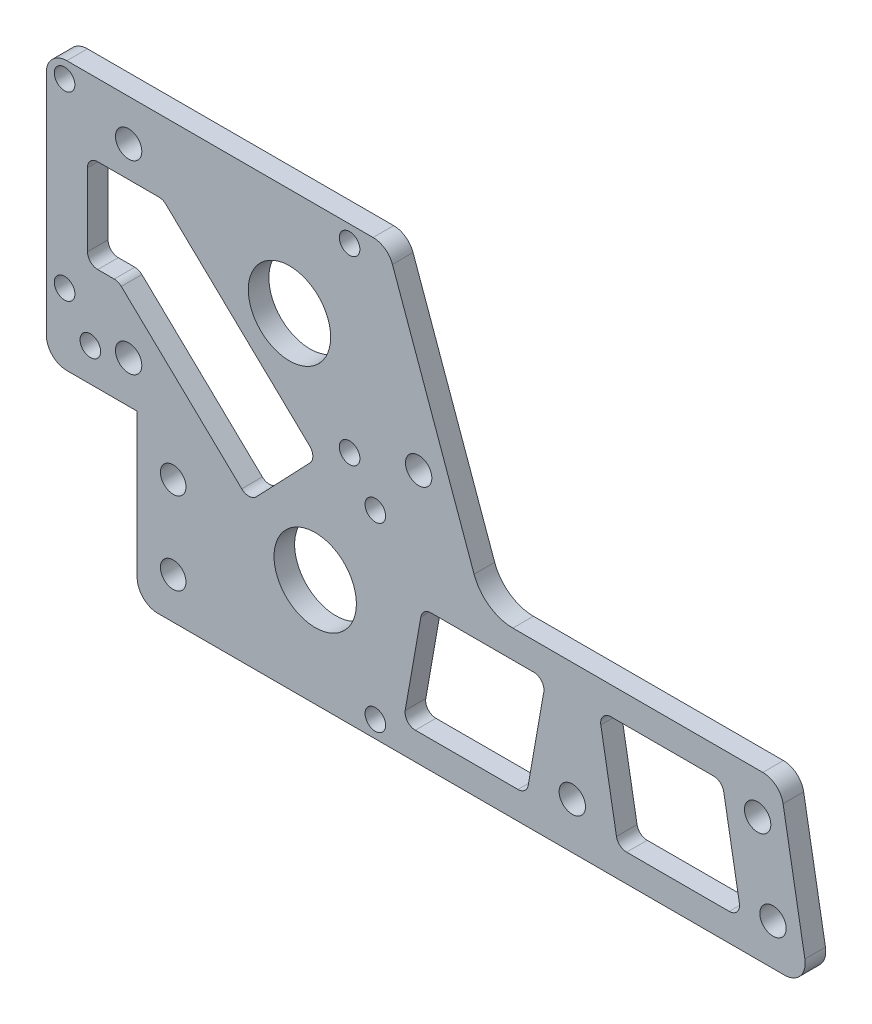
from build123d import *

# Parameters (mm, degrees)
BOSS_EXTRUDE1_DEPTH = 3.175
SKETCH2_R           = 6.35
SKETCH2_R_2         = 1.5875
SKETCH2_R_3         = 2.032
CUT_EXTRUDE1_DEPTH  = 123.537765163
SKETCH3_R           = 2.032
SKETCH3_R_2         = 1.9685
CUT_EXTRUDE2_DEPTH  = 123.537765163
FILLET1_R           = 3.175
SKETCH4_R           = 2.032
CUT_EXTRUDE3_DEPTH  = 123.027997459
CUT_EXTRUDE4_REACH  = 124.028
FILLET2_R           = 1.5875


with BuildPart() as part:
    # Sketch1 → Boss-Extrude1 (new body)
    with BuildSketch(Plane.XY):
        with BuildLine():
            Line((102.692805421, 0), (-0.911395616, 0))
            Line((-0.911395616, 0), (-0.911395616, 25.4))
            Line((-0.911395616, 25.4), (-14.924855892, 25.4))
            Line((-14.924855892, 25.4), (-14.924855892, 63.605318816))
            ThreePointArc((-14.924855892, 63.605318816), (-13.994919922, 65.850382846), (-11.749855892, 66.780318816))
            Line((-11.749855892, 66.780318816), (35.462394108, 66.780318816))
            ThreePointArc((35.462394108, 66.780318816), (37.289381836, 66.201997626), (38.450803758, 64.677714623))
            Line((38.450803758, 64.677714623), (51.036631355, 29.605208386))
            ThreePointArc((51.036631355, 29.605208386), (53.359475199, 26.556642379), (57.013450653, 25.4))
            Line((57.013450653, 25.4), (98.214100111, 25.4))
            Line((98.214100111, 25.4), (102.692805421, 0))
        make_face()
    extrude(amount=BOSS_EXTRUDE1_DEPTH)

    # Sketch2 → Cut-Extrude1 (cut, through all)
    with BuildSketch(Plane.XY.offset(3.175)):
        with Locations((22.571894108, 50.206818816)):
            Circle(SKETCH2_R)
        with Locations((26.540644108, 16.5735)):
            Circle(SKETCH2_R)
        with Locations((-8.130355892, 30.5435)):
            Circle(SKETCH2_R_2)
        with Locations((35.811644108, 30.5435)):
            Circle(SKETCH2_R_2)
        with Locations((35.811644108, 2.6035)):
            Circle(SKETCH2_R_2)
        with Locations((-8.130355892, 2.6035)):
            Circle(SKETCH2_R_2)
        with Locations((-12.099105892, 36.236818816)):
            Circle(SKETCH2_R_2)
        with Locations((31.842894108, 36.236818816)):
            Circle(SKETCH2_R_2)
        with Locations((31.842894108, 64.176818816)):
            Circle(SKETCH2_R_2)
        with Locations((-12.099105892, 64.176818816)):
            Circle(SKETCH2_R_2)
        with Locations((66.180305421, 7.14375)):
            Circle(SKETCH2_R_3)
    extrude(amount=-CUT_EXTRUDE1_DEPTH, mode=Mode.SUBTRACT)

    # Sketch3 → Cut-Extrude2 (cut, through all)
    with BuildSketch(Plane(origin=(0, 0, 0), x_dir=(-1, 0, 0), z_dir=(0, 0, -1))):
        with Locations((-42.489558108, 39.189568816)):
            Circle(SKETCH3_R)
        with Locations((-4.644854384, 19.05)):
            Circle(SKETCH3_R_2)
        with Locations((-4.644854384, 6.35)):
            Circle(SKETCH3_R_2)
    extrude(amount=-CUT_EXTRUDE2_DEPTH, mode=Mode.SUBTRACT)

    # Fillet1
    fillet1_edges = [part.edges().sort_by_distance(p)[0] for p in [
        (102.692805421, 0, 1.5875),
        (98.214100111, 25.4, 1.5875),
        (-14.924855892, 25.4, 1.5875),
        (-0.911395616, 0, 1.5875),
    ]]
    fillet(fillet1_edges, radius=FILLET1_R)

    # Sketch4 → Cut-Extrude3 (cut, through all)
    with BuildSketch(Plane.XY.offset(3.175)):
        with Locations((94.755305421, 19.05)):
            Circle(SKETCH4_R)
        with Locations((97.126377465, 6.35)):
            Circle(SKETCH4_R)
        with Locations((-2.224855892, 60.430318816)):
            Circle(SKETCH4_R)
        with Locations((-2.224855892, 31.855318816)):
            Circle(SKETCH4_R)
    extrude(amount=-CUT_EXTRUDE3_DEPTH, mode=Mode.SUBTRACT)

    # Sketch5 → Cut-Extrude4 (cut, up to next)
    with BuildSketch(Plane(origin=(0, 0, 0), x_dir=(-1, 0, 0), z_dir=(0, 0, -1)), mode=Mode.PRIVATE) as cut_extrude4_sk1:
        Polygon((-3.064970502, 55.667818816), (-26.831361929, 32.965995206), (-16.361313511, 22.004969641), (3.812355892, 41.275), (8.574855892, 41.275), (8.574855892, 55.667818816), align=None)
    cut_extrude4_tool1 = extrude(cut_extrude4_sk1.sketch, amount=-CUT_EXTRUDE4_REACH, mode=Mode.PRIVATE) & part.part
    # Sketch5 → Cut-Extrude4 (cut, up to next)
    with BuildSketch(Plane(origin=(0, 0, 0), x_dir=(-1, 0, 0), z_dir=(0, 0, -1)), mode=Mode.PRIVATE) as cut_extrude4_sk2:
        Polygon((-92.270683803, 4.2545), (-89.29642955, 21.122334072), (-70.24642955, 21.122334072), (-73.220683803, 4.2545), align=None)
    cut_extrude4_tool2 = extrude(cut_extrude4_sk2.sketch, amount=-CUT_EXTRUDE4_REACH, mode=Mode.PRIVATE) & part.part
    # Sketch5 → Cut-Extrude4 (cut, up to next)
    with BuildSketch(Plane(origin=(0, 0, 0), x_dir=(-1, 0, 0), z_dir=(0, 0, -1)), mode=Mode.PRIVATE) as cut_extrude4_sk3:
        Polygon((-40.089927038, 4.2545), (-59.139927038, 4.2545), (-62.114181291, 21.122334072), (-43.064181291, 21.122334072), align=None)
    cut_extrude4_tool3 = extrude(cut_extrude4_sk3.sketch, amount=-CUT_EXTRUDE4_REACH, mode=Mode.PRIVATE) & part.part
    add(cut_extrude4_tool1.solids().sort_by_distance((7.67675, 40.461869, 0))[0], mode=Mode.SUBTRACT)
    add(cut_extrude4_tool2.solids().sort_by_distance((81.258557, 12.688417, 0))[0], mode=Mode.SUBTRACT)
    add(cut_extrude4_tool3.solids().sort_by_distance((51.102054, 12.688417, 0))[0], mode=Mode.SUBTRACT)

    # Fillet2
    fillet2_edges = [part.edges().sort_by_distance(p)[0] for p in [
        (73.220683803, 4.2545, 1.5875),
        (92.270683803, 4.2545, 1.5875),
        (89.29642955, 21.122334072, 1.5875),
        (70.24642955, 21.122334072, 1.5875),
        (40.089927038, 4.2545, 1.5875),
        (59.139927038, 4.2545, 1.5875),
        (62.114181291, 21.122334072, 1.5875),
        (43.064181291, 21.122334072, 1.5875),
        (16.361313511, 22.004969641, 1.5875),
        (26.831361929, 32.965995206, 1.5875),
        (3.064970502, 55.667818816, 1.5875),
        (-8.574855892, 41.275, 1.5875),
        (-8.574855892, 55.667818816, 1.5875),
        (-3.812355892, 41.275, 1.5875),
    ]]
    fillet(fillet2_edges, radius=FILLET2_R)


solid = part.part
